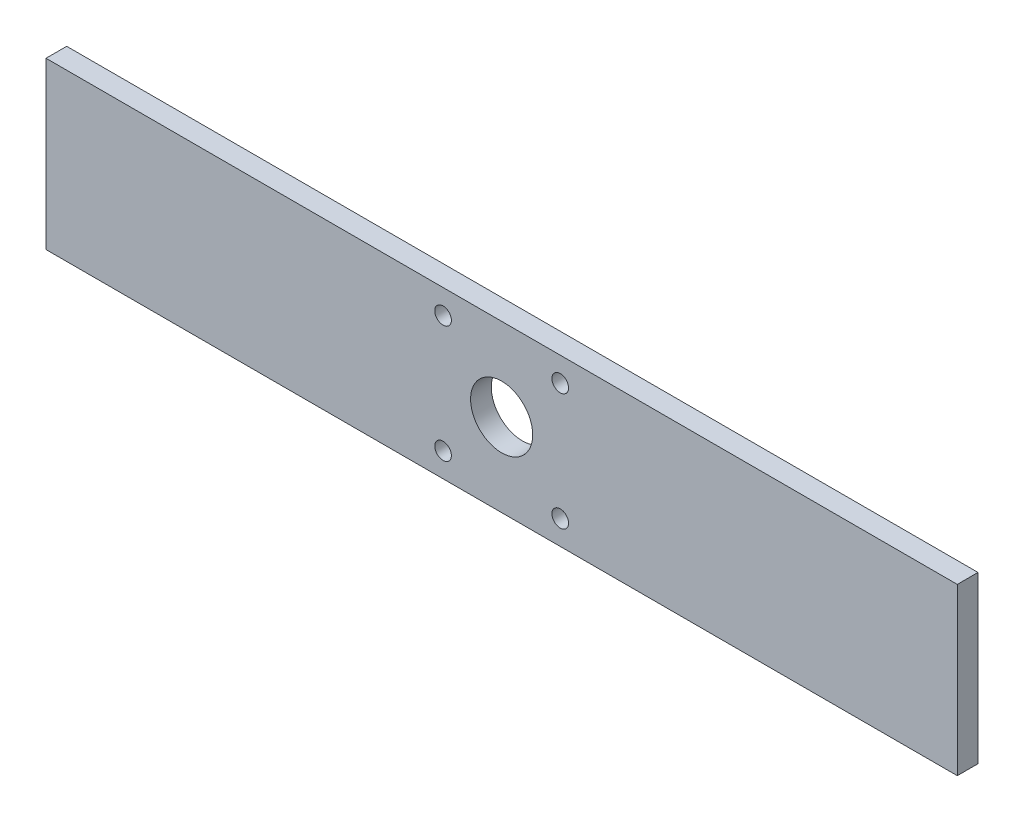
from build123d import *

# Parameters (mm, degrees)
SKETCH1_W                  = 279.4
SKETCH1_H                  = 50.8
BOSS_EXTRUDE1_DEPTH        = 6.35
SKETCH2_R                  = 9.525
CUT_EXTRUDE1_DEPTH         = 143.132235964
F_7_0_201_DIAMETER_HOLE1_D = 5.1054
CIRPATTERN1_COUNT          = 4


with BuildPart() as part:
    # Sketch1 → Boss-Extrude1 (new body)
    with BuildSketch(Plane.XY):
        Rectangle(SKETCH1_W, SKETCH1_H)
    extrude(amount=BOSS_EXTRUDE1_DEPTH)

    # Sketch2 → Cut-Extrude1 (cut, through all)
    with BuildSketch(Plane.XY.offset(6.35)):
        Circle(SKETCH2_R)
    extrude(amount=-CUT_EXTRUDE1_DEPTH, mode=Mode.SUBTRACT)

    # #7 (0.201) Diameter Hole1 (through all)
    with Locations(Plane.XY.offset(6.35)):
        with Locations((17.960512242, 17.960512242)):
            f_7_0_201_diameter_hole1 = Hole(F_7_0_201_DIAMETER_HOLE1_D / 2)

    # CirPattern1: #7 (0.201) Diameter Hole1 ×4 about axis
    cirpattern1_axis = Axis((0, 0, 0), (0, 0, 1))
    for i in range(1, CIRPATTERN1_COUNT):
        add(f_7_0_201_diameter_hole1.rotate(cirpattern1_axis, i * 360 / CIRPATTERN1_COUNT), mode=Mode.SUBTRACT)


solid = part.part
